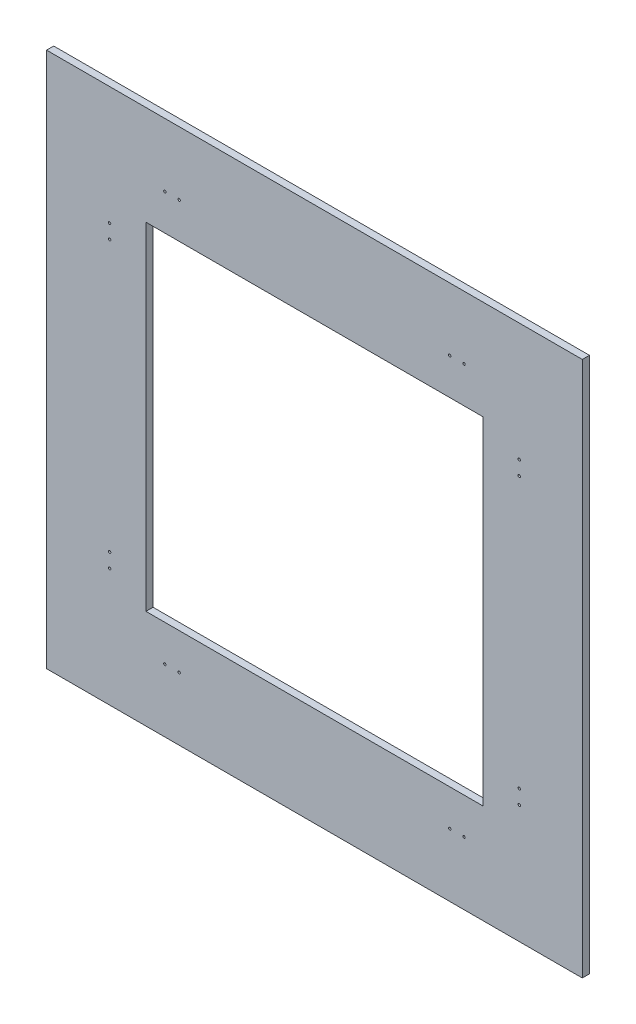
from build123d import *

# Parameters (mm, degrees)
SKIZZE1_W                       = 1200
SKIZZE1_H                       = 1200
SKIZZE1_W_2                     = 755
SKIZZE1_H_2                     = 755
AUFSATZ_LINEAR_AUSTRAGEN1_DEPTH = 16
DURCHGANGSLOCH_F_R_M51_D        = 5.5
DURCHGANGSLOCH_F_R_M51_DEPTH    = 16
DURCHGANGSLOCH_F_R_M51_TIP      = 1.652366702


with BuildPart() as part:
    # Skizze1 → Aufsatz-Linear austragen1 (new body)
    with BuildSketch(Plane.XY):
        Rectangle(SKIZZE1_W, SKIZZE1_H)
        Rectangle(SKIZZE1_W_2, SKIZZE1_H_2, mode=Mode.SUBTRACT)
    extrude(amount=AUFSATZ_LINEAR_AUSTRAGEN1_DEPTH)

    # Durchgangsloch für M51
    with Locations(Plane.XY.offset(16)):
        with Locations((-303.031849307, -458.84523437), (-335.031849307, -458.84523437), (-458.84523437, -335.031849307), (-458.84523437, -303.031849307), (-458.84523437, 335.031849307), (-458.84523437, 303.257930685), (-303.031849307, 458.117596445), (-335.031849307, 458.117596445), (335.031849307, 458.84523437), (303.031849307, 458.84523437), (458.84523437, 335.031849307), (458.84523437, 303.031849307), (458.84523437, -303.031849307), (458.84523437, -335.031849307), (303.031849307, -458.84523437), (335.031849307, -458.84523437)):
            Hole(DURCHGANGSLOCH_F_R_M51_D / 2, depth=DURCHGANGSLOCH_F_R_M51_DEPTH)
            with Locations((0, 0, -(DURCHGANGSLOCH_F_R_M51_DEPTH + DURCHGANGSLOCH_F_R_M51_TIP / 2))):  # 118° drill point
                Cone(0, DURCHGANGSLOCH_F_R_M51_D / 2, DURCHGANGSLOCH_F_R_M51_TIP, mode=Mode.SUBTRACT)


solid = part.part
